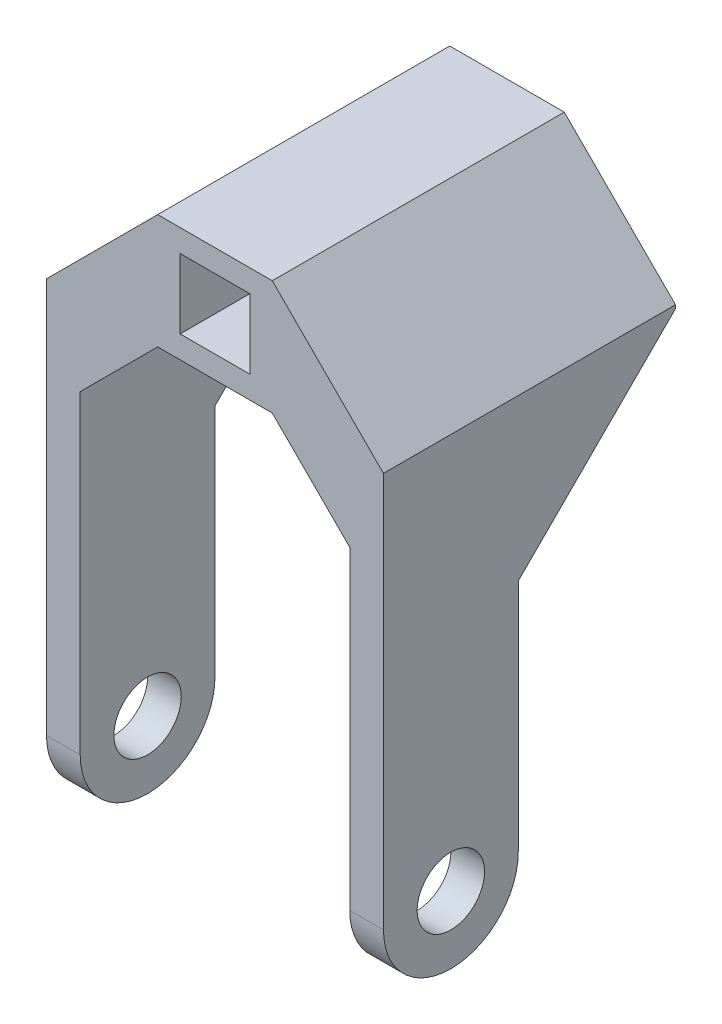
from build123d import *

# Parameters (mm, degrees)
BOSS_EXTRUDE1_DEPTH      = 30
BOSS_EXTRUDE1_DEPTH_BACK = 100
SKETCH2_W                = 31
SKETCH2_H                = 31
CUT_EXTRUDE1_DEPTH       = 258.827946507
CUT_EXTRUDE1_DEPTH_BACK  = 258.827946507
CUT_EXTRUDE2_DEPTH       = 258.827946507
CUT_EXTRUDE2_DEPTH_BACK  = 258.827946507
SKETCH4_R                = 15
FILLET1_R                = 30


with BuildPart() as part:
    # Sketch2 → Boss-Extrude1 (new, two sides: drawn at the far end of the back side and taken through both)
    with BuildSketch(Plane.XY.offset(-BOSS_EXTRUDE1_DEPTH_BACK)):
        Polygon((-25.5, 174.5), (25.5, 174.5), (60, 140), (60, -30), (75, -30), (75, 176), (25.5, 225.5), (-25.5, 225.5), (-75, 176), (-75, -30), (-60, -30), (-60, 140), align=None)
        with Locations((0, 200)):
            Rectangle(SKETCH2_W, SKETCH2_H, mode=Mode.SUBTRACT)
    extrude(amount=BOSS_EXTRUDE1_DEPTH + BOSS_EXTRUDE1_DEPTH_BACK)

    # Sketch3 → Cut-Extrude1 (cut, two sides: drawn at the far end of the back side and taken through both)
    with BuildSketch(Plane(origin=(0, 0, 0), x_dir=(0, 0, -1), z_dir=(1, 0, 0)).offset(-CUT_EXTRUDE1_DEPTH_BACK)):
        Polygon((30, -30), (30, 104.5), (100, 174.5), (100, -30), align=None)
    extrude(amount=CUT_EXTRUDE1_DEPTH + CUT_EXTRUDE1_DEPTH_BACK, mode=Mode.SUBTRACT)

    # Sketch4 → Cut-Extrude2 (cut, two sides: drawn at the far end of the back side and taken through both)
    with BuildSketch(Plane(origin=(0, 0, 0), x_dir=(0, 0, -1), z_dir=(1, 0, 0)).offset(-CUT_EXTRUDE2_DEPTH_BACK)):
        Circle(SKETCH4_R)
    extrude(amount=CUT_EXTRUDE2_DEPTH + CUT_EXTRUDE2_DEPTH_BACK, mode=Mode.SUBTRACT)

    # Fillet1
    fillet1_edges = [part.edges().sort_by_distance(p)[0] for p in [
        (67.5, -30, -30),
        (-67.5, -30, -30),
        (-67.5, -30, 30),
        (67.5, -30, 30),
    ]]
    fillet(fillet1_edges, radius=FILLET1_R - 0.0001)  # a hair under: the kernel refuses the full size


solid = part.part
